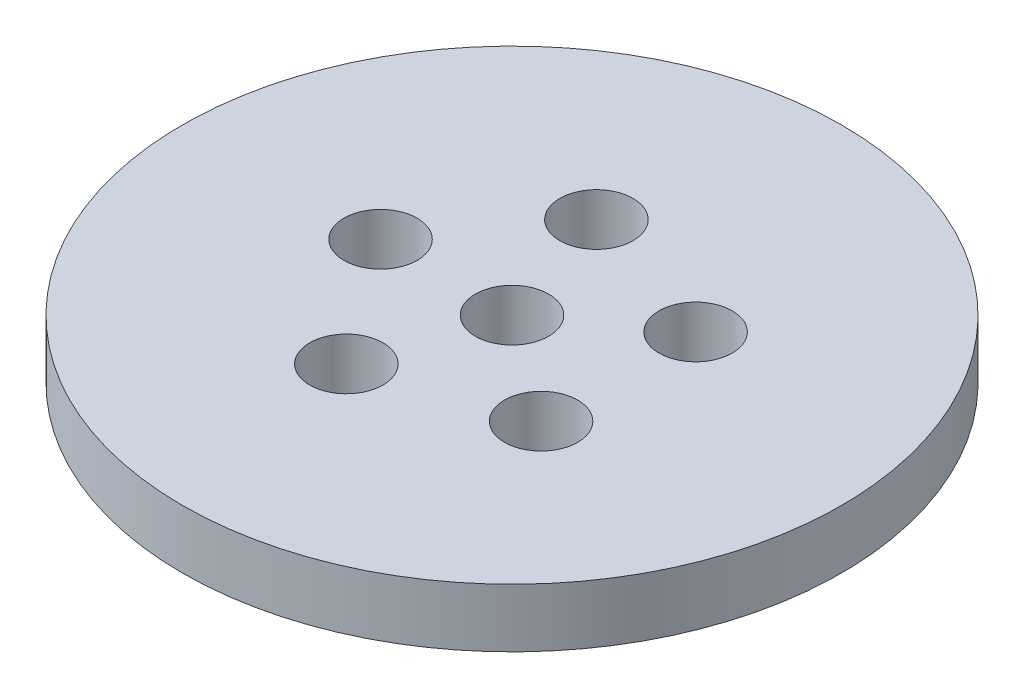
from build123d import *

# Parameters (mm, degrees)
SKETCH1_R           = 90
BOSS_EXTRUDE1_DEPTH = 16
SKETCH2_R           = 10
CUT_EXTRUDE1_DEPTH  = 129.280941687
SKETCH3_R           = 10
CUT_EXTRUDE2_DEPTH  = 14.85330385
CIRPATTERN1_COUNT   = 5


with BuildPart() as part:
    # Sketch1 → Boss-Extrude1 (new body)
    with BuildSketch(Plane(origin=(0, 0, 0), x_dir=(1, 0, 0), z_dir=(0, 1, 0))):
        Circle(SKETCH1_R)
    extrude(amount=BOSS_EXTRUDE1_DEPTH)

    # Sketch2 → Cut-Extrude1 (cut, through all)
    with BuildSketch(Plane(origin=(0, 0, 0), x_dir=(1, 0, 0), z_dir=(0, 1, 0))):
        Circle(SKETCH2_R)
    extrude(amount=CUT_EXTRUDE1_DEPTH, mode=Mode.SUBTRACT)

    # Sketch3 → Cut-Extrude2 (cut)
    with BuildSketch(Plane(origin=(0, 16, 0), x_dir=(1, 0, 0), z_dir=(0, 1, 0))):
        with Locations((-35.902775508, 0)):
            Circle(SKETCH3_R)
    cut_extrude2 = extrude(amount=-CUT_EXTRUDE2_DEPTH, mode=Mode.SUBTRACT)

    # CirPattern1: Cut-Extrude2 ×5 about axis
    cirpattern1_axis = Axis((0, 0, 0), (0, 1, 0))
    for i in range(1, CIRPATTERN1_COUNT):
        add(cut_extrude2.rotate(cirpattern1_axis, i * 360 / CIRPATTERN1_COUNT), mode=Mode.SUBTRACT)


solid = part.part
